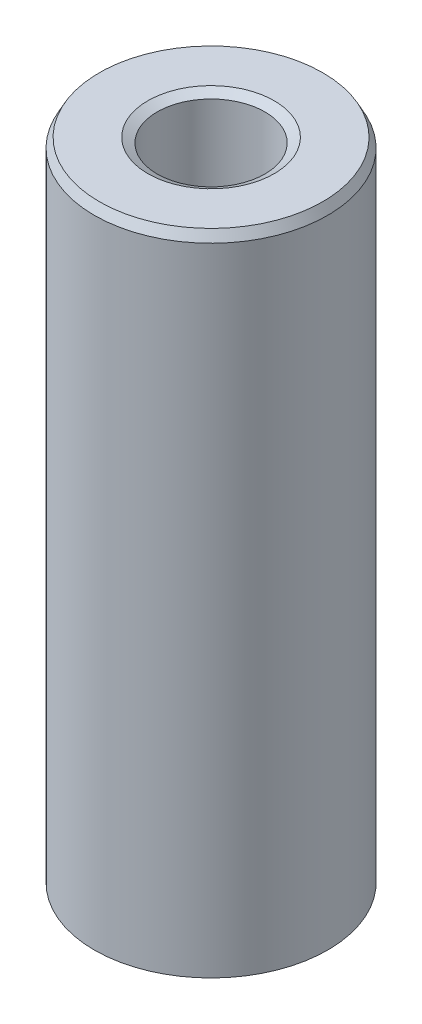
from build123d import *
from OCP.BRepFilletAPI import BRepFilletAPI_MakeChamfer

# Parameters (mm, degrees)
SKETCH1_R           = 25
BOSS_EXTRUDE1_DEPTH = 139.373056533
SKETCH2_R           = 11.540079575
CUT_EXTRUDE1_DEPTH  = 144.787512974
CHAMFER1_SIZE       = 2.001828142
CHAMFER1_SIZE2      = 1.06443118


with BuildPart() as part:
    # Sketch1 → Boss-Extrude1 (new body)
    with BuildSketch(Plane(origin=(0, 0, 0), x_dir=(1, 0, 0), z_dir=(0, 1, 0))):
        Circle(SKETCH1_R)
    extrude(amount=BOSS_EXTRUDE1_DEPTH)

    # Sketch2 → Cut-Extrude1 (cut, through all)
    with BuildSketch(Plane(origin=(0, 0, 0), x_dir=(1, 0, 0), z_dir=(0, 1, 0))):
        Circle(SKETCH2_R)
    extrude(amount=CUT_EXTRUDE1_DEPTH, mode=Mode.SUBTRACT)

    # Chamfer1: one chamfer whose edges measure the first distance from different faces: ONE call of the kernel's chamfer builder (chamfer() names one face for all edges)
    chamfer1_edges_1 = [part.edges().sort_by_distance(p)[0] for p in [
        (-11.540079575, 139.373056533, 0),
    ]]
    chamfer1_side_1 = [part.faces().sort_by_distance(p)[0] for p in [
        (-24.292893219, 139.373056533, 0),
    ]]
    chamfer1_edges_2 = [part.edges().sort_by_distance(p)[0] for p in [
        (-11.540079575, 0, 0),
    ]]
    chamfer1_side_2 = [part.faces().sort_by_distance(p)[0] for p in [
        (-11.540079575, 69.686528266, 0),
    ]]
    chamfer1_edges_3 = [part.edges().sort_by_distance(p)[0] for p in [
        (-25, 0, 0),
    ]]
    chamfer1_side_3 = [part.faces().sort_by_distance(p)[0] for p in [
        (-24.292893219, 0, 0),
    ]]
    chamfer1_edges_4 = [part.edges().sort_by_distance(p)[0] for p in [
        (-25, 139.373056533, 0),
    ]]
    chamfer1_side_4 = [part.faces().sort_by_distance(p)[0] for p in [
        (-25, 69.686528266, 0),
    ]]
    chamfer1 = BRepFilletAPI_MakeChamfer(part.part.solid().wrapped)
    for e in chamfer1_edges_1:
        chamfer1.Add(CHAMFER1_SIZE, CHAMFER1_SIZE2, e.wrapped, chamfer1_side_1[0].wrapped)  # the first distance lies on this face
    for e in chamfer1_edges_2:
        chamfer1.Add(CHAMFER1_SIZE, CHAMFER1_SIZE2, e.wrapped, chamfer1_side_2[0].wrapped)  # the first distance lies on this face
    for e in chamfer1_edges_3:
        chamfer1.Add(CHAMFER1_SIZE, CHAMFER1_SIZE2, e.wrapped, chamfer1_side_3[0].wrapped)  # the first distance lies on this face
    for e in chamfer1_edges_4:
        chamfer1.Add(CHAMFER1_SIZE, CHAMFER1_SIZE2, e.wrapped, chamfer1_side_4[0].wrapped)  # the first distance lies on this face
    add(Compound.cast(chamfer1.Shape()), mode=Mode.REPLACE)


solid = part.part
